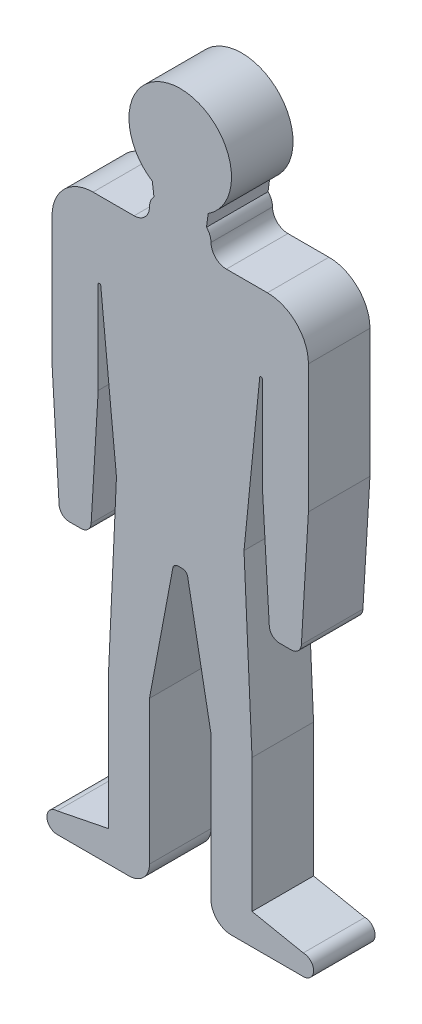
from build123d import *

# Parameters (mm, degrees)
SKETCH1_R            = 127
SKETCH1_W            = 76.2
SKETCH1_H            = 660.4
SKETCH1_W_2          = 101.6
SKETCH1_H_2          = 762
SKETCH1_W_3          = 228.6
SKETCH1_H_3          = 50.8
SKETCH1_W_4          = 152.4
SKETCH1_H_4          = 76.2
BOSS_EXTRUDE1_DEPTH  = 152.4
SKETCH2_W            = 406.4
SKETCH2_H            = 50.8
BOSS_EXTRUDE2_DEPTH  = 152.4
BOSS_EXTRUDE3_DEPTH  = 152.4
BOSS_EXTRUDE4_DEPTH  = 152.4
BOSS_EXTRUDE5_DEPTH  = 152.4
CUT_EXTRUDE1_DEPTH   = 152.4
SKETCH7_W            = 279.4
SKETCH7_H            = 114.872803244
BOSS_EXTRUDE6_DEPTH  = 152.4
BOSS_EXTRUDE7_DEPTH  = 152.4
SKETCH9_W            = 38.1
SKETCH9_H            = 736.6
BOSS_EXTRUDE8_DEPTH  = 152.4
FILLET2_R            = 101.6
CUT_EXTRUDE2_DEPTH   = 152.4
FILLET3_R            = 50.8
FILLET5_START        = -1
FILLET5_DEPTH        = 154
FILLET5_2_DEPTH      = 152.4
FILLET6_R            = 12.7
FILLET7_R            = 25.4
FILLET8_R            = 3.175
BOSS_EXTRUDE9_DEPTH  = 152.4
BOSS_EXTRUDE10_DEPTH = 152.4


with BuildPart() as part:
    # Sketch1 → Boss-Extrude1 (new body)
    with BuildSketch(Plane.XY):
        with Locations(Location((76.2, 1625.6, 0), (0, 0, 180))):
            Circle(SKETCH1_R)
        Polygon((-101.6, 812.8), (0, 812.8), (152.4, 812.8), (254, 812.8), (254, 1346.2), (254, 1422.4), (152.4, 1422.4), (0, 1422.4), (-101.6, 1422.4), (-101.6, 1346.2), align=None)
        Polygon((-127, 1346.2), (-101.6, 1346.2), (-101.6, 1422.4), (-203.2, 1422.4), (-203.2, 1346.2), align=None)
        with Locations((-165.1, 1016)):
            Rectangle(SKETCH1_W, SKETCH1_H)
        Polygon((254, 1422.4), (254, 1346.2), (279.4, 1346.2), (355.6, 1346.2), (355.6, 1422.4), align=None)
        with Locations((317.5, 1016)):
            Rectangle(SKETCH1_W, SKETCH1_H)
        with Locations((203.2, 431.8)):
            Rectangle(SKETCH1_W_2, SKETCH1_H_2)
        with Locations((-50.8, 431.8)):
            Rectangle(SKETCH1_W_2, SKETCH1_H_2)
        with Locations((-114.3, 25.4)):
            Rectangle(SKETCH1_W_3, SKETCH1_H_3)
        Polygon((254, 50.8), (152.4, 50.8), (152.4, 0), (381, 0), (381, 50.8), align=None)
        with BuildLine():
            ThreePointArc((381, 50.8), (406.4, 25.4), (381, 0))
            Line((381, 0), (381, 50.8))
        make_face()
        with BuildLine():
            ThreePointArc((-228.6, 0), (-254, 25.4), (-228.6, 50.8))
            Line((-228.6, 50.8), (-228.6, 0))
        make_face()
        with Locations((76.2, 1460.5)):
            Rectangle(SKETCH1_W_4, SKETCH1_H_4)
    extrude(amount=BOSS_EXTRUDE1_DEPTH)

    # Sketch2 → Boss-Extrude2 (add)
    with BuildSketch(Plane.XY.offset(152.4)):
        with Locations((76.2, 1320.8)):
            Rectangle(SKETCH2_W, SKETCH2_H)
    extrude(amount=-BOSS_EXTRUDE2_DEPTH)

    # Sketch3 → Boss-Extrude3 (add)
    with BuildSketch(Plane.XY.offset(152.4)):
        Polygon((76.2, 812.8), (0, 406.4), (0, 812.8), align=None)
    extrude(amount=-BOSS_EXTRUDE3_DEPTH)

    # Sketch4 → Boss-Extrude4 (add)
    with BuildSketch(Plane.XY.offset(152.4)):
        Polygon((76.2, 812.8), (152.4, 812.8), (152.4, 406.4), align=None)
    extrude(amount=-BOSS_EXTRUDE4_DEPTH)

    # Sketch5 → Boss-Extrude5 (add)
    with BuildSketch(Plane.XY.offset(152.4)):
        Polygon((-228.6, 50.8), (-101.6, 76.2), (-101.6, 50.8), align=None)
        Polygon((254, 76.2), (254, 50.8), (381, 50.8), align=None)
    extrude(amount=-BOSS_EXTRUDE5_DEPTH)

    # Sketch6 → Cut-Extrude1 (cut)
    with BuildSketch(Plane.XY.offset(152.4)):
        Polygon((-101.6, 406.4), (-81.750104461, 840.402248986), (-101.6, 1295.4), align=None)
        Polygon((254, 406.4), (234.150104461, 840.402248986), (254, 1295.4), align=None)
    extrude(amount=-CUT_EXTRUDE1_DEPTH, mode=Mode.SUBTRACT)

    # Sketch7 → Boss-Extrude6 (add)
    with BuildSketch(Plane.XY.offset(152.4)):
        with Locations((57.949895539, 782.965847364)):
            Rectangle(SKETCH7_W, SKETCH7_H)
    extrude(amount=-BOSS_EXTRUDE6_DEPTH)

    # Sketch8 → Boss-Extrude7 (add)
    with BuildSketch(Plane.XY.offset(152.4)):
        Polygon((-81.750104461, 840.402248986), (-127, 1295.4), (-61.647363893, 1295.4), align=None)
        Polygon((214.047363893, 1295.4), (234.150104461, 840.402248986), (279.4, 1295.4), align=None)
    extrude(amount=-BOSS_EXTRUDE7_DEPTH)

    # Sketch9 → Boss-Extrude8 (add)
    with BuildSketch(Plane.XY.offset(152.4)):
        with Locations((-222.25, 1054.1)):
            Rectangle(SKETCH9_W, SKETCH9_H)
        with Locations((374.65, 1054.1)):
            Rectangle(SKETCH9_W, SKETCH9_H)
    extrude(amount=-BOSS_EXTRUDE8_DEPTH)

    # Fillet2
    fillet2_edges = [part.edges().sort_by_distance(p)[0] for p in [
        (-241.3, 1422.4, 76.2),
        (393.7, 1422.4, 76.2),
    ]]
    fillet(fillet2_edges, radius=FILLET2_R)

    # Sketch10 → Cut-Extrude2 (cut)
    with BuildSketch(Plane.XY.offset(152.4)):
        Polygon((-241.3, 1003.3), (-222.469288436, 685.8), (-241.3, 685.8), align=None)
        Polygon((-145.830711564, 685.8), (-127, 685.8), (-127, 1003.3), align=None)
        Polygon((279.4, 1003.3), (298.230711564, 685.8), (279.4, 685.8), align=None)
        Polygon((374.869288436, 685.8), (393.7, 685.8), (393.7, 1003.3), align=None)
    extrude(amount=-CUT_EXTRUDE2_DEPTH, mode=Mode.SUBTRACT)

    # Fillet3
    fillet3_edges = [part.edges().sort_by_distance(p)[0] for p in [
        (152.4, 0, 76.2),
        (0, 0, 76.2),
    ]]
    fillet(fillet3_edges, radius=FILLET3_R)

    # Fillet5: read off the stored shape, not the designer's step
    # Fillet5 outline → Fillet5 (cut)
    with BuildSketch(Plane.XY.offset(FILLET5_START)):
        with BuildLine():
            ThreePointArc((0, 1460.5), (11.159231637, 1487.440768363), (38.1, 1498.6))
            Line((38.1, 1498.6), (0, 1498.6))
            Line((0, 1498.6), (0, 1460.5))
        make_face()
        with BuildLine():
            ThreePointArc((114.3, 1498.6), (141.240768363, 1487.440768363), (152.4, 1460.5))
            Line((152.4, 1460.5), (152.4, 1498.6))
            Line((152.4, 1498.6), (114.3, 1498.6))
        make_face()
    extrude(amount=FILLET5_DEPTH, mode=Mode.SUBTRACT)

    # Fillet5 2 outline → Fillet5 2 (add)
    with BuildSketch(Plane.XY):
        with BuildLine():
            Line((152.4, 1422.4), (190.5, 1422.4))
            ThreePointArc((190.5, 1422.4), (163.559231637, 1433.559231637), (152.4, 1460.5))
            Line((152.4, 1460.5), (152.4, 1422.4))
        make_face()
        with BuildLine():
            Line((0, 1422.4), (0, 1460.5))
            ThreePointArc((0, 1460.5), (-11.159231637, 1433.559231637), (-38.1, 1422.4))
            Line((-38.1, 1422.4), (0, 1422.4))
        make_face()
    extrude(amount=FILLET5_2_DEPTH)

    # Fillet6
    fillet6_edges = [part.edges().sort_by_distance(p)[0] for p in [
        (92.563228923, 725.529445742, 76.2),
        (59.836771077, 725.529445742, 76.2),
    ]]
    fillet(fillet6_edges, radius=FILLET6_R)

    # Fillet7
    fillet7_edges = [part.edges().sort_by_distance(p)[0] for p in [
        (-222.469288436, 685.8, 76.2),
        (-145.830711564, 685.8, 76.2),
        (298.230711564, 685.8, 76.2),
        (374.869288436, 685.8, 76.2),
    ]]
    fillet(fillet7_edges, radius=FILLET7_R)

    # Fillet8
    fillet8_edges = [part.edges().sort_by_distance(p)[0] for p in [
        (279.4, 1295.4, 76.2),
        (-127, 1295.4, 76.2),
    ]]
    fillet(fillet8_edges, radius=FILLET8_R)

    # Sketch11 → Boss-Extrude9 (add)
    with BuildSketch(Plane.XY.offset(152.4)):
        Polygon((6.96991061, 1519.128432325), (11.159231637, 1487.440768363), (76.2, 1498.6), align=None)
    extrude(amount=-BOSS_EXTRUDE9_DEPTH)

    # Sketch12 → Boss-Extrude10 (add)
    with BuildSketch(Plane.XY.offset(152.4)):
        Polygon((145.43008939, 1519.128432325), (76.2, 1498.6), (141.240768363, 1487.440768363), align=None)
    extrude(amount=-BOSS_EXTRUDE10_DEPTH)


solid = part.part
